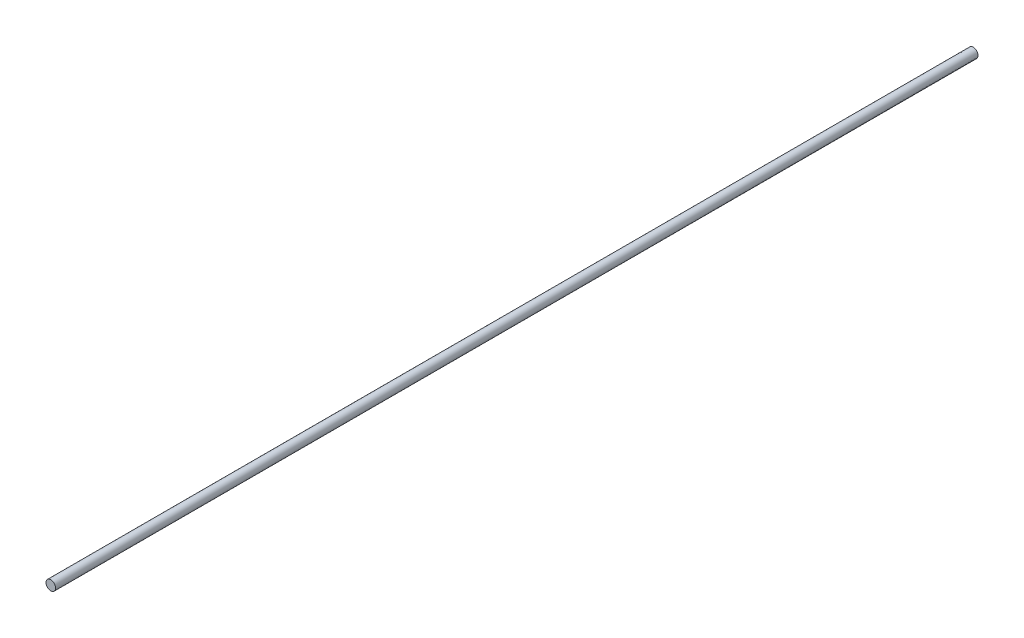
from build123d import *

# Parameters (mm, degrees)
SKETCH1_R           = 3.175
BOSS_EXTRUDE1_DEPTH = 609.6


with BuildPart() as part:
    # Sketch1 → Boss-Extrude1 (new body)
    with BuildSketch(Plane.XY):
        Circle(SKETCH1_R)
    extrude(amount=BOSS_EXTRUDE1_DEPTH)


solid = part.part
